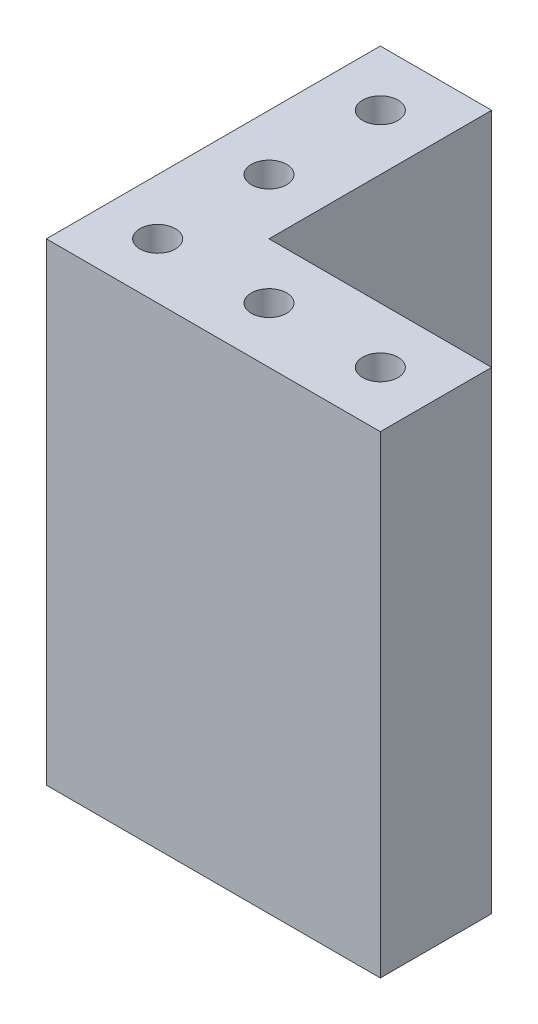
from build123d import *

# Parameters (mm, degrees)
SKETCH1_R           = 2.0193
BOSS_EXTRUDE1_DEPTH = 53.975


with BuildPart() as part:
    # Sketch1 → Boss-Extrude1 (new body)
    with BuildSketch(Plane(origin=(0, 0, 0), x_dir=(1, 0, 0), z_dir=(0, 1, 0))):
        Polygon((-6.35, -6.35), (31.75, -6.35), (31.75, 6.35), (6.35, 6.35), (6.35, 31.75), (-6.35, 31.75), align=None)
        Circle(SKETCH1_R, mode=Mode.SUBTRACT)
        with Locations((12.7, 0)):
            Circle(SKETCH1_R, mode=Mode.SUBTRACT)
        with Locations((25.4, 0)):
            Circle(SKETCH1_R, mode=Mode.SUBTRACT)
        with Locations((0, 12.7)):
            Circle(SKETCH1_R, mode=Mode.SUBTRACT)
        with Locations((0, 25.4)):
            Circle(SKETCH1_R, mode=Mode.SUBTRACT)
    extrude(amount=BOSS_EXTRUDE1_DEPTH)


solid = part.part
